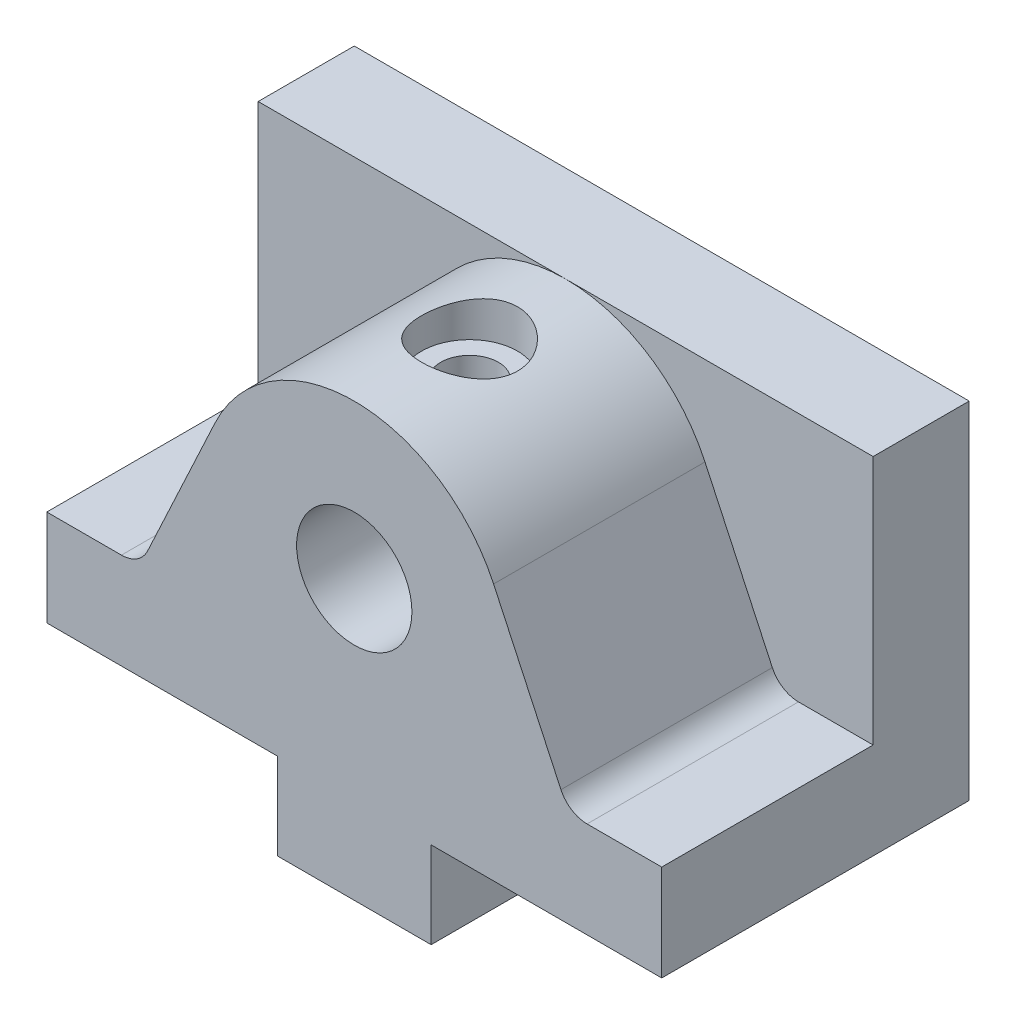
from build123d import *

# Parameters (mm, degrees)
BOSS_EXTRUDE2_DEPTH                      = 22
BOSS_EXTRUDE3_DEPTH                      = 10
FILLET1_R                                = 3
SKETCH3_R                                = 6
CUT_EXTRUDE1_DEPTH                       = 24
SKETCH4_R                                = 3
CUT_EXTRUDE2_DEPTH                       = 16
CBORE_START                              = 32
CBORE_FOR_M12_HEX_HEAD_BOLT3_OUTLINE_R   = 5
CBORE_FOR_M12_HEX_HEAD_BOLT3_DEPTH       = 4
CBORE_START_2                            = 25.196151292
CBORE_FOR_M12_HEX_HEAD_BOLT3_2_OUTLINE_R = 3
CBORE_FOR_M12_HEX_HEAD_BOLT3_2_DEPTH     = 6.803848708


# Read off the part's stored shape, not the designer's step: CBORE for M12 Hex Head Bolt3
with BuildPart() as part:
    # Sketch2 → Boss-Extrude2 (new body)
    with BuildSketch(Plane.XY):
        with BuildLine():
            Line((9.682876715, 10), (0, 10))
            Line((0, 10), (0, 0))
            Line((0, 0), (24, 0))
            Line((24, 0), (24, -9))
            Line((24, -9), (40, -9))
            Line((40, -9), (40, 0))
            Line((40, 0), (64, 0))
            Line((64, 0), (64, 10))
            Line((64, 10), (54.317123285, 10))
            Line((54.317123285, 10), (46.500924593, 26.761892188))
            ThreePointArc((46.500924593, 26.761892188), (32, 36), (17.499075407, 26.761892188))
            Line((17.499075407, 26.761892188), (9.682876715, 10))
        make_face()
    extrude(amount=BOSS_EXTRUDE2_DEPTH)

    # Sketch2<4> → Boss-Extrude3 (add)
    with BuildSketch(Plane.XY):
        Polygon((0, 0), (24, 0), (24, -9), (40, -9), (40, 0), (64, 0), (64, 36), (0, 36), align=None)
    extrude(amount=-BOSS_EXTRUDE3_DEPTH)

    # Fillet1
    fillet1_edges = [part.edges().sort_by_distance(p)[0] for p in [
        (54.317123285, 10, 11),
        (9.682876715, 10, 11),
    ]]
    fillet(fillet1_edges, radius=FILLET1_R)

    # Sketch3 → Cut-Extrude1 (cut)
    with BuildSketch(Plane.XY.offset(22)):
        with Locations((32, 20)):
            Circle(SKETCH3_R)
    extrude(amount=-CUT_EXTRUDE1_DEPTH, mode=Mode.SUBTRACT)

    # Sketch4 → Cut-Extrude2 (cut)
    with BuildSketch(Plane.XZ.offset(9)):
        with Locations((32, 14)):
            Circle(SKETCH4_R)
        with Locations((32, -2)):
            Circle(SKETCH4_R)
    extrude(amount=-CUT_EXTRUDE2_DEPTH, mode=Mode.SUBTRACT)

    # CBORE for M12 Hex Head Bolt3 outline → CBORE for M12 Hex Head Bolt3 (cut)
    with BuildSketch(Plane(origin=(0, 0, 0), x_dir=(1, 0, 0), z_dir=(0, 1, 0)).offset(CBORE_START)):
        with Locations((32, -10)):
            Circle(CBORE_FOR_M12_HEX_HEAD_BOLT3_OUTLINE_R)
    extrude(amount=CBORE_FOR_M12_HEX_HEAD_BOLT3_DEPTH, mode=Mode.SUBTRACT)

    # CBORE for M12 Hex Head Bolt3 2 outline → CBORE for M12 Hex Head Bolt3 2 (cut)
    with BuildSketch(Plane(origin=(0, 0, 0), x_dir=(1, 0, 0), z_dir=(0, 1, 0)).offset(CBORE_START_2)):
        with Locations((32, -10)):
            Circle(CBORE_FOR_M12_HEX_HEAD_BOLT3_2_OUTLINE_R)
    extrude(amount=CBORE_FOR_M12_HEX_HEAD_BOLT3_2_DEPTH, mode=Mode.SUBTRACT)


solid = part.part
